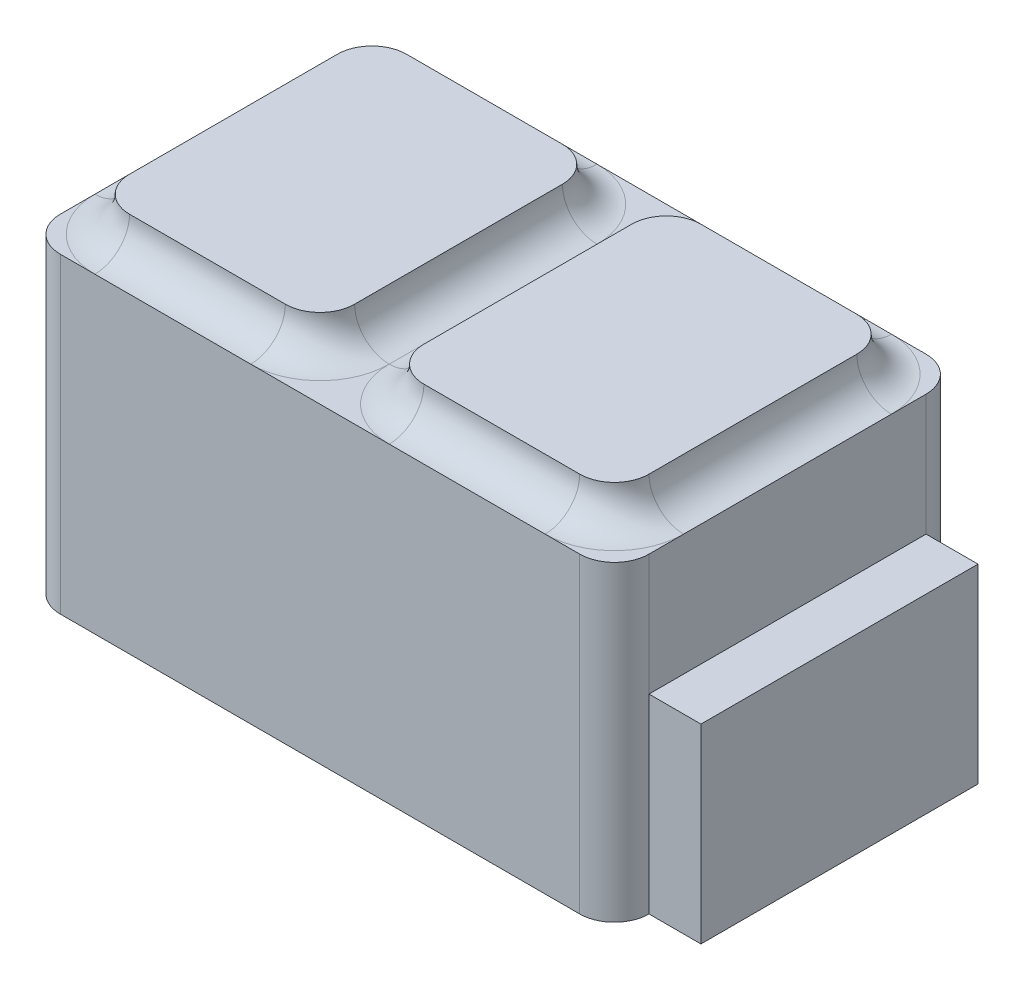
from build123d import *

# Parameters (mm, degrees)
BOSS_EXTRUDE1_DEPTH = 10
SKETCH2_W           = 14
SKETCH2_H           = 7
SKETCH2_R           = 1.75
CUT_EXTRUDE1_DEPTH  = 8
SKETCH3_W           = 1
SKETCH3_H           = 2
BOSS_EXTRUDE2_DEPTH = 14
SKETCH4_W           = 1.5
SKETCH4_H           = 8
BOSS_EXTRUDE3_DEPTH = 5.5
SKETCH5_W           = 17
SKETCH5_H           = 10
SKETCH5_W_2         = 6.5
SKETCH5_H_2         = 8
CUT_EXTRUDE2_DEPTH  = 1
FILLET2_R           = 1


with BuildPart() as part:
    # Sketch1 → Boss-Extrude1 (new body)
    with BuildSketch(Plane(origin=(0, 0, 0), x_dir=(1, 0, 0), z_dir=(0, 1, 0))):
        with BuildLine():
            Line((-7.5, -5), (7.5, -5))
            ThreePointArc((7.5, -5), (8.207106781, -4.707106781), (8.5, -4))
            Line((8.5, -4), (8.5, 4))
            ThreePointArc((8.5, 4), (8.207106781, 4.707106781), (7.5, 5))
            Line((7.5, 5), (-7.5, 5))
            ThreePointArc((-7.5, 5), (-8.207106781, 4.707106781), (-8.5, 4))
            Line((-8.5, 4), (-8.5, -4))
            ThreePointArc((-8.5, -4), (-8.207106781, -4.707106781), (-7.5, -5))
        make_face()
    extrude(amount=BOSS_EXTRUDE1_DEPTH)

    # Sketch2 → Cut-Extrude1 (cut)
    with BuildSketch(Plane(origin=(0, 0, 0), x_dir=(1, 0, 0), z_dir=(0, 1, 0))):
        Rectangle(SKETCH2_W, SKETCH2_H)
        with Locations(Location((0, 0, 0), (0, 0, 270))):
            Circle(SKETCH2_R, mode=Mode.SUBTRACT)
    extrude(amount=CUT_EXTRUDE1_DEPTH, mode=Mode.SUBTRACT)

    # Sketch3 → Boss-Extrude2 (add)
    with BuildSketch(Plane(origin=(-7, 0, 0), x_dir=(0, 0, -1), z_dir=(1, 0, 0))):
        with Locations((0, 1)):
            Rectangle(SKETCH3_W, SKETCH3_H)
    extrude(amount=BOSS_EXTRUDE2_DEPTH)

    # Sketch4 → Boss-Extrude3 (add)
    with BuildSketch(Plane.XZ):
        with Locations((9.25, 0)):
            Rectangle(SKETCH4_W, SKETCH4_H)
    extrude(amount=-BOSS_EXTRUDE3_DEPTH)

    # Sketch5 → Cut-Extrude2 (cut)
    with BuildSketch(Plane(origin=(0, 10, 0), x_dir=(1, 0, 0), z_dir=(0, 1, 0))):
        Rectangle(SKETCH5_W, SKETCH5_H)
        with Locations((-4.25, 0)):
            Rectangle(SKETCH5_W_2, SKETCH5_H_2, mode=Mode.SUBTRACT)
        with Locations((4.25, 0)):
            Rectangle(SKETCH5_W_2, SKETCH5_H_2, mode=Mode.SUBTRACT)
    extrude(amount=-CUT_EXTRUDE2_DEPTH, mode=Mode.SUBTRACT)

    # Fillet2
    fillet2_edges = [part.edges().sort_by_distance(p)[0] for p in [
        (-7.5, 9.5, -4),
        (-1, 9.5, -4),
        (-1, 9.5, 4),
        (-7.5, 9.5, 4),
        (1, 9.5, -4),
        (7.5, 9.5, -4),
        (7.5, 9.5, 4),
        (1, 9.5, 4),
        (1, 9, 0),
        (4.25, 9, 4),
        (7.5, 9, 0),
        (4.25, 9, -4),
        (-7.5, 9, 0),
        (-4.25, 9, 4),
        (-1, 9, 0),
        (-4.25, 9, -4),
    ]]
    fillet(fillet2_edges, radius=FILLET2_R - 0.0001)  # a hair under: the kernel refuses the full size


solid = part.part
